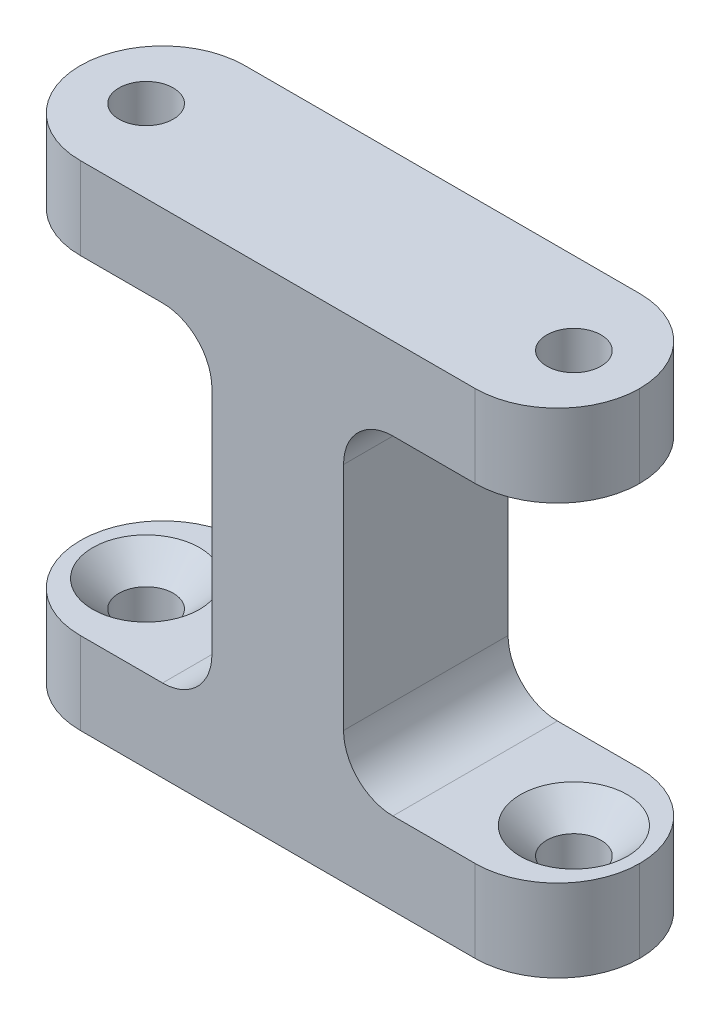
from build123d import *

# Parameters (mm, degrees)
BOSS_EXTRUDE1_DEPTH     = 10
CUT_EXTRUDE1_DEPTH      = 47.432747065
CUT_EXTRUDE1_DEPTH_BACK = 47.432747065
SKETCH2_R               = 1.65
CHAMFER1_SIZE           = 1.6
FILLET1_R               = 3
FILLET3_R               = 5


with BuildPart() as part:
    # Sketch1 → Boss-Extrude1 (new body)
    with BuildSketch(Plane.XY):
        Polygon((0, 0), (0, 5), (-13, 5), (-13, 25), (0, 25), (0, 30), (-34, 30), (-34, 25), (-21, 25), (-21, 5), (-34, 5), (-34, 0), align=None)
    extrude(amount=BOSS_EXTRUDE1_DEPTH)

    # Sketch2 → Cut-Extrude1 (cut, two sides: drawn at the far end of the back side and taken through both)
    with BuildSketch(Plane(origin=(0, 30, 0), x_dir=(1, 0, 0), z_dir=(0, 1, 0)).offset(-CUT_EXTRUDE1_DEPTH_BACK)):
        with Locations(Location((-30, -5, 0), (0, 0, 180))):
            Circle(SKETCH2_R)
        with Locations(Location((-4, -5, 0), (0, 0, 180))):
            Circle(SKETCH2_R)
    extrude(amount=CUT_EXTRUDE1_DEPTH + CUT_EXTRUDE1_DEPTH_BACK, mode=Mode.SUBTRACT)

    # Chamfer1
    chamfer1_edges = [part.edges().sort_by_distance(p)[0] for p in [
        (-28.35, 5, 5),
        (-2.35, 5, 5),
    ]]
    chamfer(chamfer1_edges, length=CHAMFER1_SIZE)

    # Fillet1
    fillet1_edges = [part.edges().sort_by_distance(p)[0] for p in [
        (-21, 5, 5),
        (-21, 25, 5),
        (-13, 25, 5),
        (-13, 5, 5),
    ]]
    fillet(fillet1_edges, radius=FILLET1_R)

    # Fillet3
    fillet3_edges = [part.edges().sort_by_distance(p)[0] for p in [
        (-34, 2.5, 0),
        (-34, 2.5, 10),
        (0, 2.5, 10),
        (0, 2.5, 0),
        (0, 27.5, 0),
        (0, 27.5, 10),
        (-34, 27.5, 0),
        (-34, 27.5, 10),
    ]]
    fillet(fillet3_edges, radius=FILLET3_R - 0.0001)  # a hair under: the kernel refuses the full size


solid = part.part
